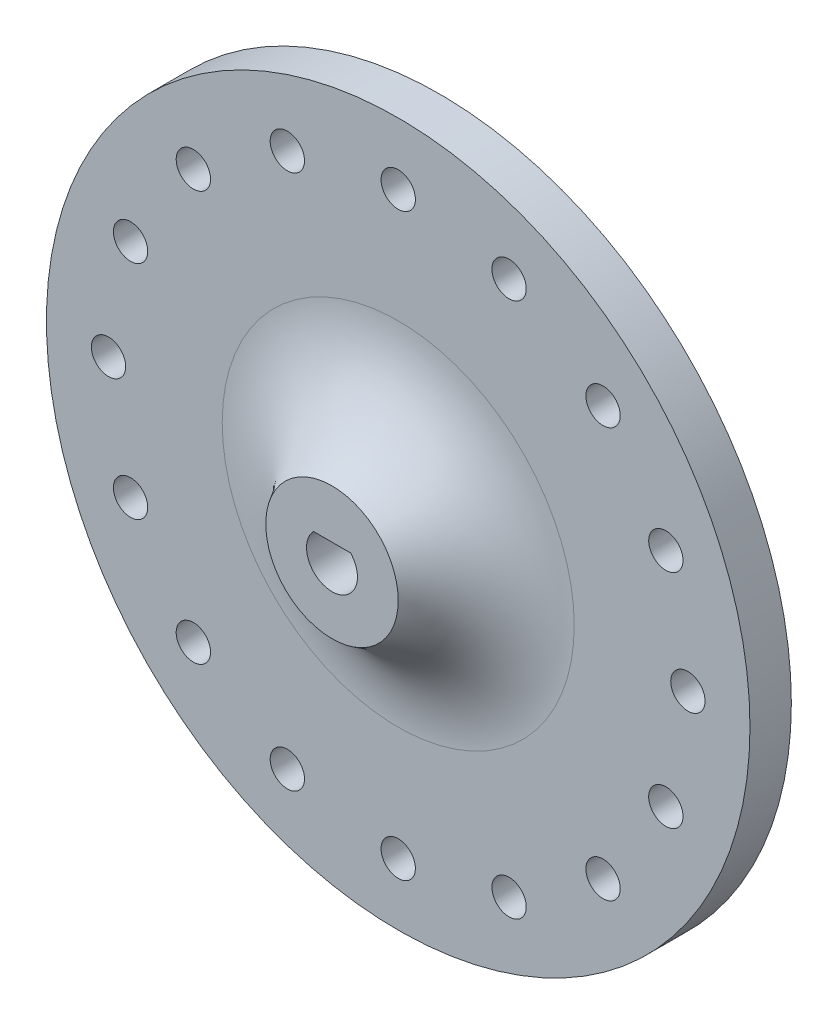
from build123d import *
from build123d.topology import SkipClean

# Parameters (mm, degrees)
ESBO_O1_R                = 42.5
RESSALTO_EXTRUS_O1_DEPTH = 5
ESBO_O2_R                = 8
RESSALTO_EXTRUS_O2_DEPTH = 8
FILETE3_R                = 15
ESBO_O3_R                = 2.075
CORTE_EXTRUS_O1_DEPTH    = 61.634148794
PADR_OCIRCULAR1_COUNT    = 16
CORTE_EXTRUS_O2_DEPTH    = 61.634148794


with BuildPart() as part:
    # Esboço1 → Ressalto-extrusão1 (new body)
    with BuildSketch(Plane.XY):
        Circle(ESBO_O1_R)
    extrude(amount=RESSALTO_EXTRUS_O1_DEPTH)

    # Esboço2 → Ressalto-extrusão2 (add)
    with BuildSketch(Plane.XY.offset(5)):
        Circle(ESBO_O2_R)
        with BuildLine():
            Line((-2.24624687, 2.1), (2.24624687, 2.1))
            ThreePointArc((2.24624687, 2.1), (0, -3.075), (-2.24624687, 2.1))
        make_face(mode=Mode.SUBTRACT)
    extrude(amount=RESSALTO_EXTRUS_O2_DEPTH)

    # Filete3
    # the kernel refuses this fillet: 15 mm, written as the material it adds along each edge
    with BuildSketch(Plane(origin=(0, 0, 5), x_dir=(1, 0, 0), z_dir=(0, -1, 0))) as filete3_piece_1:
        with BuildLine():
            CenterArc((21.266499161, 15), FILETE3_R, 207.818139285, 62.181860715)
            Line((8, 8), (7.734670017, 7.86))
            ThreePointArc((7.734670017, 7.86), (7.7, 4), (7.7, 0))
            Line((7.7, 0), (8, -0.3))
            Line((8, -0.3), (21.266499161, -0.3))
            Line((21.266499161, -0.3), (21.266499161, 0))
        make_face()
    revolve(axis=Axis((0, 0, 5), (0, 0, 1)))

    # Esboço3 → Corte-extrusão1 (cut, through all)
    with BuildSketch(Plane.XY.offset(5)):
        with Locations((0, 35)):
            Circle(ESBO_O3_R)
    corte_extrus_o1 = extrude(amount=-CORTE_EXTRUS_O1_DEPTH, mode=Mode.SUBTRACT)

    # PadrãoCircular1: Corte-extrusão1 ×16 about axis
    padr_ocircular1_axis = Axis((0, 0, 0), (0, 0, 1))
    for i in range(1, PADR_OCIRCULAR1_COUNT):
        add(corte_extrus_o1.rotate(padr_ocircular1_axis, i * 360 / PADR_OCIRCULAR1_COUNT), mode=Mode.SUBTRACT)

    # Esboço4 → Corte-extrusão2 (cut, through all)
    with SkipClean():  # the faces are left unmerged after this step: merging them gives an invalid solid
        with BuildSketch(Plane.XY.offset(5)):
            with BuildLine():
                Line((2.24624687, 2.1), (-2.24624687, 2.1))
                ThreePointArc((-2.24624687, 2.1), (0, -3.075), (2.24624687, 2.1))
            make_face()
        extrude(amount=-CORTE_EXTRUS_O2_DEPTH, mode=Mode.SUBTRACT)
    add(part.part.scale(1), mode=Mode.REPLACE)  # the faces are merged on a copy


solid = part.part
